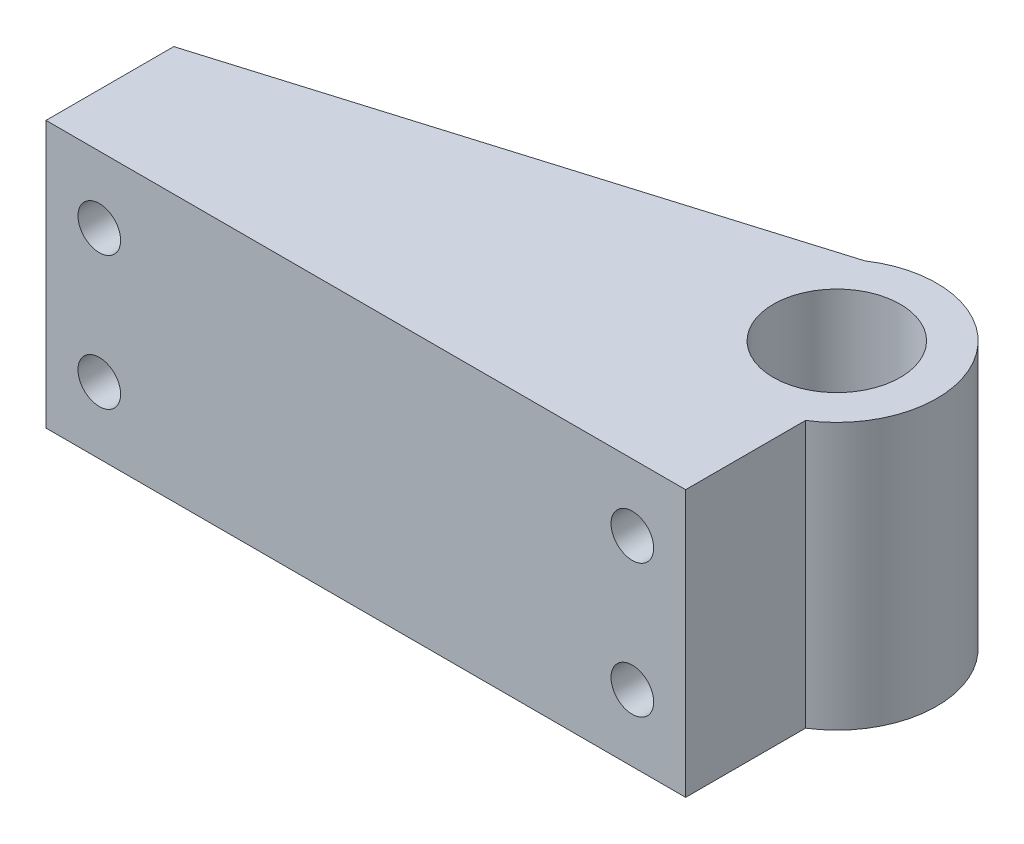
from build123d import *

# Parameters (mm, degrees)
SKETCH1_W           = 10.16
SKETCH1_H           = 5.08
SKETCH1_R           = 6.049999965
BOSS_EXTRUDE1_DEPTH = 25.4
SKETCH6_W           = 11.43
SKETCH6_H           = 25.4
BOSS_EXTRUDE3_DEPTH = 50.8
CHAMFER2_DEPTH      = 25.4
SKETCH4_R           = 2.032
CUT_EXTRUDE2_DEPTH  = 12.7


with BuildPart() as part:
    # Sketch1 → Boss-Extrude1 (new body)
    # profile 1 of 4: a face of its own
    with BuildSketch(Plane(origin=(0, 0, 0), x_dir=(1, 0, 0), z_dir=(0, 1, 0))):
        with BuildLine():
            Line((-5.08, -8.057246738), (-5.08, -14.407246738))
            Line((-5.08, -14.407246738), (5.08, -14.407246738))
            Line((5.08, -14.407246738), (5.08, -8.057246738))
            ThreePointArc((5.08, -8.057246738), (0, -9.525), (-5.08, -8.057246738))
        make_face()
    # profile 2 of 4: a face of its own
    with BuildSketch(Plane(origin=(0, 0, 0), x_dir=(1, 0, 0), z_dir=(0, 1, 0))):
        with Locations((0, -16.947246738)):
            Rectangle(SKETCH1_W, SKETCH1_H)
    # profile 3 of 4: a face of its own
    with BuildSketch(Plane(origin=(0, 0, 0), x_dir=(1, 0, 0), z_dir=(0, 1, 0))):
        with BuildLine():
            ThreePointArc((9.525, 0), (-4.601012117, 8.340042716), (-5.08, -8.057246738))
            Line((-5.08, -8.057246738), (5.08, -8.057246738))
            ThreePointArc((5.08, -8.057246738), (8.340042716, -4.601012117), (9.525, 0))
        make_face()
        with Locations(Location((0, 0, 0), (0, 0, 270))):
            Circle(SKETCH1_R, mode=Mode.SUBTRACT)
    # profile 4 of 4: a face of its own
    with BuildSketch(Plane(origin=(0, 0, 0), x_dir=(1, 0, 0), z_dir=(0, 1, 0))):
        with BuildLine():
            Line((5.08, -8.057246738), (-5.08, -8.057246738))
            ThreePointArc((-5.08, -8.057246738), (0, -9.525), (5.08, -8.057246738))
        make_face()
    extrude(amount=BOSS_EXTRUDE1_DEPTH)

    # Sketch6 → Boss-Extrude3 (add)
    with BuildSketch(Plane.ZY.offset(5.08)):
        with Locations((13.772246738, 12.7)):
            Rectangle(SKETCH6_W, SKETCH6_H)
    extrude(amount=BOSS_EXTRUDE3_DEPTH)

    # Chamfer2: read off the stored shape, not the designer's step
    # Chamfer2 outline → Chamfer2 (add)
    with BuildSketch(Plane(origin=(0, 0, 0), x_dir=(1, 0, 0), z_dir=(0, 1, 0))):
        with BuildLine():
            Line((-5.261303905, 7.940044472), (-55.88, -7.308719642))
            Line((-55.88, -7.308719642), (-55.88, -8.057246738))
            Line((-55.88, -8.057246738), (-5.08, -8.057246738))
            ThreePointArc((-5.08, -8.057246738), (-9.524388334, -0.107943825), (-5.261303905, 7.940044472))
        make_face()
    extrude(amount=CHAMFER2_DEPTH)

    # Sketch4 → Cut-Extrude2 (cut)
    with BuildSketch(Plane.XY.offset(19.487246738)):
        with Locations((0, 19.05)):
            Circle(SKETCH4_R)
        with Locations((0, 6.35)):
            Circle(SKETCH4_R)
        with Locations((-50.8, 19.05)):
            Circle(SKETCH4_R)
        with Locations((-50.8, 6.35)):
            Circle(SKETCH4_R)
    extrude(amount=-CUT_EXTRUDE2_DEPTH, mode=Mode.SUBTRACT)


solid = part.part
